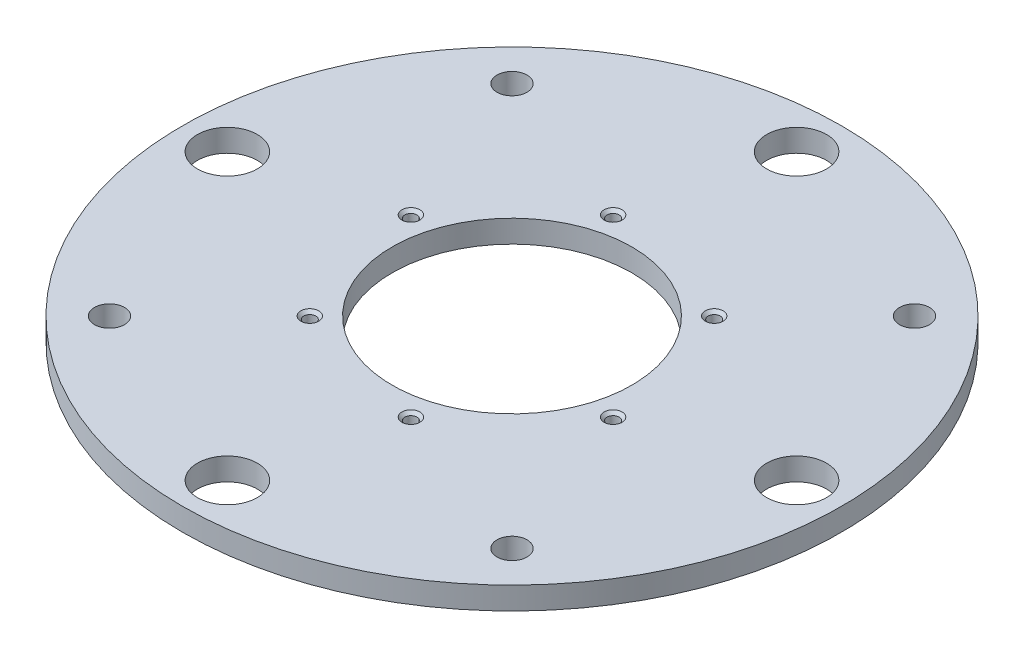
from build123d import *

# Parameters (mm, degrees)
SKETCH2_R                        = 139.7
SKETCH2_R_2                      = 50.8
BOSS_EXTRUDE1_DEPTH              = 9.525
SKETCH3_R                        = 12.6746
SKETCH3_R_2                      = 6.35
CUT_EXTRUDE2_DEPTH               = 198.795110215
F_1_4_20_TAPPED_HOLE1_AT_2_COUNT = 2
F_1_4_20_TAPPED_HOLE1_AT_2_PITCH = 60.61075
F_1_4_20_TAPPED_HOLE1_AT_3_COUNT = 2
F_1_4_20_TAPPED_HOLE1_AT_3_PITCH = 104.980898485
F_1_4_20_TAPPED_HOLE1_AT_4_COUNT = 2
F_1_4_20_TAPPED_HOLE1_AT_4_PITCH = 121.2215
F_1_4_20_TAPPED_HOLE1_AT_5_COUNT = 2
F_1_4_20_TAPPED_HOLE1_AT_5_PITCH = 104.980898485
F_1_4_20_TAPPED_HOLE1_AT_6_COUNT = 2
F_1_4_20_TAPPED_HOLE1_AT_6_PITCH = 60.61075


with BuildPart() as part:
    # Sketch2 → Boss-Extrude1 (new body)
    with BuildSketch(Plane(origin=(0, 0, 0), x_dir=(1, 0, 0), z_dir=(0, 1, 0))):
        Circle(SKETCH2_R)
        Circle(SKETCH2_R_2, mode=Mode.SUBTRACT)
    extrude(amount=BOSS_EXTRUDE1_DEPTH)

    # Sketch3 → Cut-Extrude2 (cut, through all)
    with BuildSketch(Plane(origin=(0, 9.525, 0), x_dir=(1, 0, 0), z_dir=(0, 1, 0))):
        with Locations((0, 120.65)):
            Circle(SKETCH3_R)
        with Locations((120.65, 0)):
            Circle(SKETCH3_R)
        with Locations((0, -120.65)):
            Circle(SKETCH3_R)
        with Locations((-120.65, 0)):
            Circle(SKETCH3_R)
        with Locations((85.31243315, 85.31243315)):
            Circle(SKETCH3_R_2)
        with Locations((85.31243315, -85.31243315)):
            Circle(SKETCH3_R_2)
        with Locations((-85.31243315, -85.31243315)):
            Circle(SKETCH3_R_2)
        with Locations((-85.31243315, 85.31243315)):
            Circle(SKETCH3_R_2)
    extrude(amount=-CUT_EXTRUDE2_DEPTH, mode=Mode.SUBTRACT)

    # Sketch6 → 1/4-20 Tapped Hole1 (revolve, cut)
    with BuildSketch(Plane(origin=(-58.545488776, 9.525, -15.687216438), x_dir=(0, 0, 1), z_dir=(1, 0, 0))):
        Polygon((0, 0), (0, 9.525), (3.81, 9.525), (2.5527, 8.2677), (2.5527, 1.2573), (3.81, 0), align=None)
    f_1_4_20_tapped_hole1 = revolve(axis=Axis((-58.545488776, 15.875, -15.687216438), (0, -1, 0)), mode=Mode.SUBTRACT)

    # 1/4-20 Tapped Hole1 at 2: 1/4-20 Tapped Hole1 ×2
    with Locations(*[Vector(0.707106781186523, 0, -0.7071067811865721) * (i * F_1_4_20_TAPPED_HOLE1_AT_2_PITCH) for i in range(1, F_1_4_20_TAPPED_HOLE1_AT_2_COUNT)]):
        add(f_1_4_20_tapped_hole1, mode=Mode.SUBTRACT)

    # 1/4-20 Tapped Hole1 at 3: 1/4-20 Tapped Hole1 ×2
    with Locations(*[Vector(0.9659258262890614, 0, -0.2588190451025464) * (i * F_1_4_20_TAPPED_HOLE1_AT_3_PITCH) for i in range(1, F_1_4_20_TAPPED_HOLE1_AT_3_COUNT)]):
        add(f_1_4_20_tapped_hole1, mode=Mode.SUBTRACT)

    # 1/4-20 Tapped Hole1 at 4: 1/4-20 Tapped Hole1 ×2
    with Locations(*[Vector(0.9659258262890731, 0, 0.258819045102503) * (i * F_1_4_20_TAPPED_HOLE1_AT_4_PITCH) for i in range(1, F_1_4_20_TAPPED_HOLE1_AT_4_COUNT)]):
        add(f_1_4_20_tapped_hole1, mode=Mode.SUBTRACT)

    # 1/4-20 Tapped Hole1 at 5: 1/4-20 Tapped Hole1 ×2
    with Locations(*[Vector(0.7071067811865548, 0, 0.7071067811865402) * (i * F_1_4_20_TAPPED_HOLE1_AT_5_PITCH) for i in range(1, F_1_4_20_TAPPED_HOLE1_AT_5_COUNT)]):
        add(f_1_4_20_tapped_hole1, mode=Mode.SUBTRACT)

    # 1/4-20 Tapped Hole1 at 6: 1/4-20 Tapped Hole1 ×2
    with Locations(*[Vector(0.25881904510251946, 0, 0.9659258262890686) * (i * F_1_4_20_TAPPED_HOLE1_AT_6_PITCH) for i in range(1, F_1_4_20_TAPPED_HOLE1_AT_6_COUNT)]):
        add(f_1_4_20_tapped_hole1, mode=Mode.SUBTRACT)


solid = part.part
